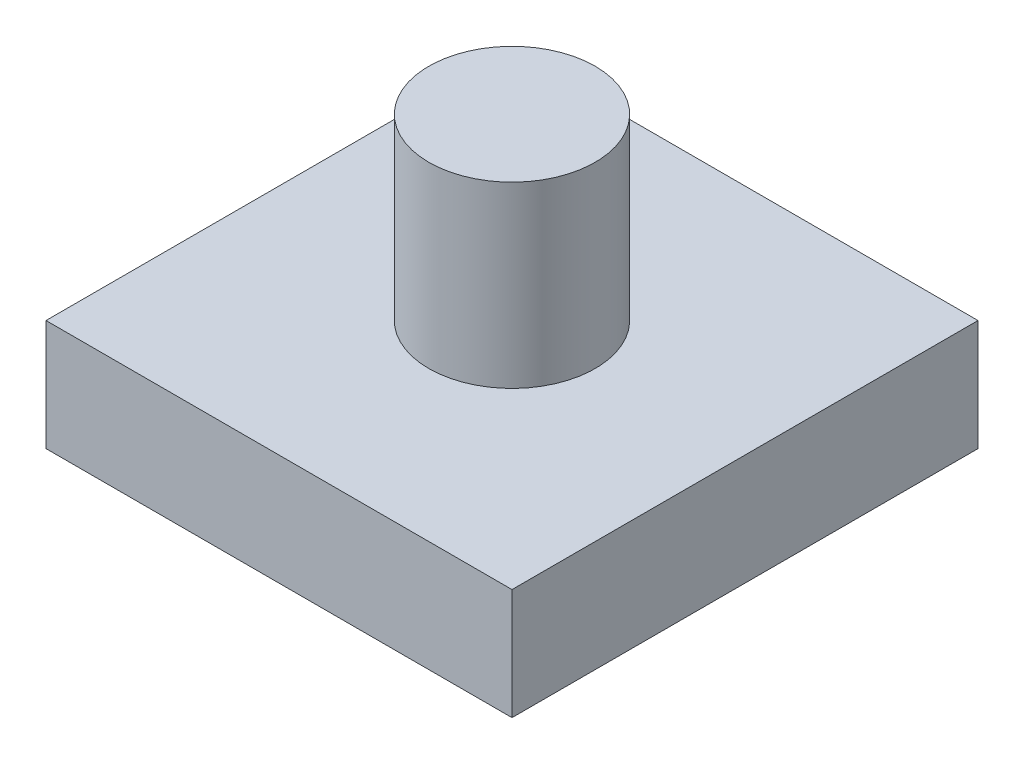
from build123d import *

# Parameters (mm, degrees)
SKETCH1_W           = 42
SKETCH1_H           = 42
BOSS_EXTRUDE1_DEPTH = 10
SKETCH1_6_R         = 7.5
BOSS_EXTRUDE2_DEPTH = 26.1


with BuildPart() as part:
    # Sketch1 → Boss-Extrude1 (new body)
    with BuildSketch(Plane(origin=(0, 0, 0), x_dir=(1, 0, 0), z_dir=(0, 1, 0))):
        Rectangle(SKETCH1_W, SKETCH1_H)
    extrude(amount=BOSS_EXTRUDE1_DEPTH)

    # Sketch1<6> → Boss-Extrude2 (add)
    with BuildSketch(Plane(origin=(0, 0, 0), x_dir=(1, 0, 0), z_dir=(0, 1, 0))):
        Circle(SKETCH1_6_R)
    extrude(amount=BOSS_EXTRUDE2_DEPTH)


solid = part.part
